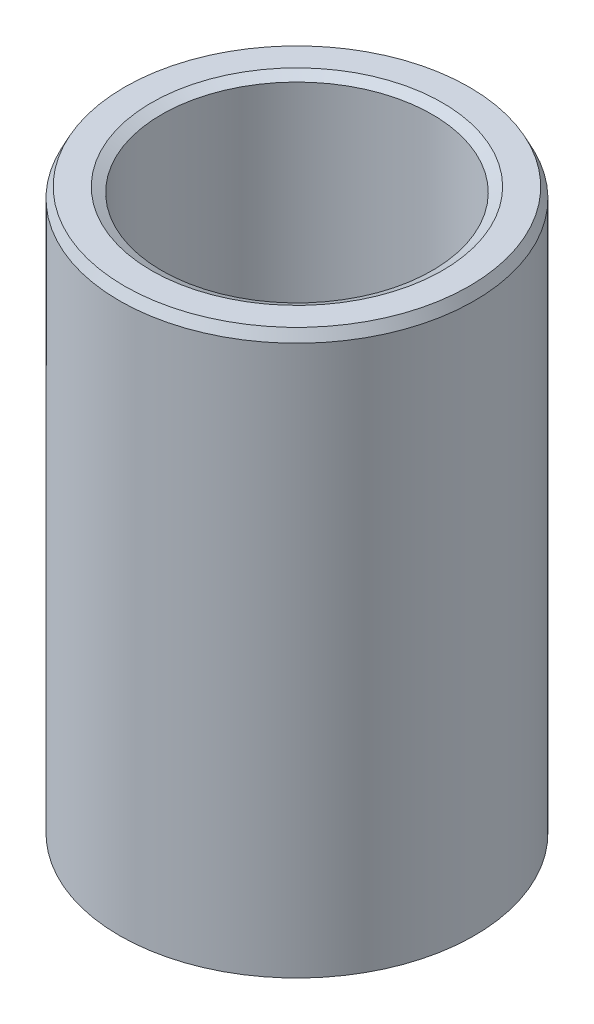
from build123d import *
from OCP.BRepFilletAPI import BRepFilletAPI_MakeChamfer

# Parameters (mm, degrees)
SKETCH1_R           = 25
BOSS_EXTRUDE1_DEPTH = 79.594309867
SKETCH2_R           = 19.058786368
CUT_EXTRUDE1_DEPTH  = 88.093364633
CHAMFER1_SIZE       = 1.432385024
CHAMFER1_SIZE2      = 0.715759922


with BuildPart() as part:
    # Sketch1 → Boss-Extrude1 (new body)
    with BuildSketch(Plane(origin=(0, 0, 0), x_dir=(1, 0, 0), z_dir=(0, 1, 0))):
        Circle(SKETCH1_R)
    extrude(amount=BOSS_EXTRUDE1_DEPTH)

    # Sketch2 → Cut-Extrude1 (cut, through all)
    with BuildSketch(Plane(origin=(0, 0, 0), x_dir=(1, 0, 0), z_dir=(0, 1, 0))):
        Circle(SKETCH2_R)
    extrude(amount=CUT_EXTRUDE1_DEPTH, mode=Mode.SUBTRACT)

    # Chamfer1: one chamfer whose edges measure the first distance from different faces: ONE call of the kernel's chamfer builder (chamfer() names one face for all edges)
    chamfer1_edges_1 = [part.edges().sort_by_distance(p)[0] for p in [
        (-19.058786368, 79.594309867, 0),
    ]]
    chamfer1_side_1 = [part.faces().sort_by_distance(p)[0] for p in [
        (-24.292893219, 79.594309867, 0),
    ]]
    chamfer1_edges_2 = [part.edges().sort_by_distance(p)[0] for p in [
        (-19.058786368, 0, 0),
    ]]
    chamfer1_side_2 = [part.faces().sort_by_distance(p)[0] for p in [
        (-19.058786368, 39.797154933, 0),
    ]]
    chamfer1_edges_3 = [part.edges().sort_by_distance(p)[0] for p in [
        (-25, 0, 0),
    ]]
    chamfer1_side_3 = [part.faces().sort_by_distance(p)[0] for p in [
        (-24.292893219, 0, 0),
    ]]
    chamfer1_edges_4 = [part.edges().sort_by_distance(p)[0] for p in [
        (-25, 79.594309867, 0),
    ]]
    chamfer1_side_4 = [part.faces().sort_by_distance(p)[0] for p in [
        (-25, 39.797154933, 0),
    ]]
    chamfer1 = BRepFilletAPI_MakeChamfer(part.part.solid().wrapped)
    for e in chamfer1_edges_1:
        chamfer1.Add(CHAMFER1_SIZE, CHAMFER1_SIZE2, e.wrapped, chamfer1_side_1[0].wrapped)  # the first distance lies on this face
    for e in chamfer1_edges_2:
        chamfer1.Add(CHAMFER1_SIZE, CHAMFER1_SIZE2, e.wrapped, chamfer1_side_2[0].wrapped)  # the first distance lies on this face
    for e in chamfer1_edges_3:
        chamfer1.Add(CHAMFER1_SIZE, CHAMFER1_SIZE2, e.wrapped, chamfer1_side_3[0].wrapped)  # the first distance lies on this face
    for e in chamfer1_edges_4:
        chamfer1.Add(CHAMFER1_SIZE, CHAMFER1_SIZE2, e.wrapped, chamfer1_side_4[0].wrapped)  # the first distance lies on this face
    add(Compound.cast(chamfer1.Shape()), mode=Mode.REPLACE)


solid = part.part
